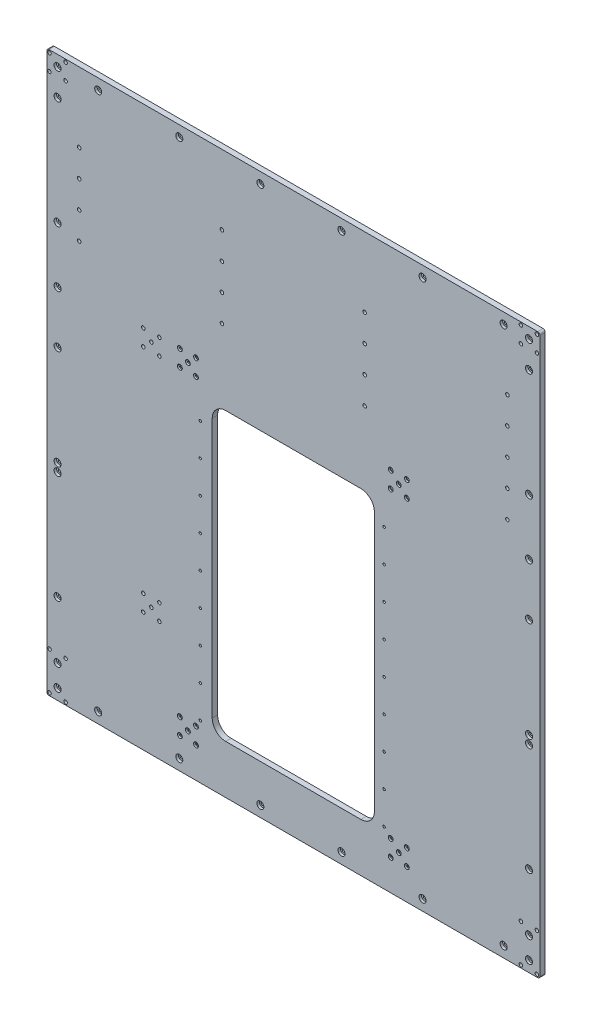
from build123d import *

# Parameters (mm, degrees)
BOSS_EXTRU_1_DEPTH                           = 10
ENL_V_MAT_EXTRU_1_DEPTH                      = 690.813199352
D_GAGEMENT_M64_D                             = 6.6
CHAMBRAGE_POUR_VIS_T_TE_RONDE_BOMB_2_COUNT   = 2
CHAMBRAGE_POUR_VIS_T_TE_RONDE_BOMB_2_PITCH   = 29.81471185
CHAMBRAGE_POUR_VIS_T_TE_RONDE_BOMB_3_COUNT   = 2
CHAMBRAGE_POUR_VIS_T_TE_RONDE_BOMB_3_PITCH   = 21.093697317
CHAMBRAGE_POUR_VIS_T_TE_RONDE_BOMB_4_COUNT   = 2
CHAMBRAGE_POUR_VIS_T_TE_RONDE_BOMB_4_PITCH   = 42.330145982
CHAMBRAGE_POUR_VIS_T_TE_RONDE_BOMB_5_COUNT   = 2
CHAMBRAGE_POUR_VIS_T_TE_RONDE_BOMB_5_PITCH   = 30.048697412
R_P_TITION_LIN_AIRE7_COUNT                   = 2
R_P_TITION_LIN_AIRE7_PITCH                   = 425
D_GAGEMENT_M41_D                             = 4.5
R_P_TITION_LIN_AIRE8_COUNT                   = 9
R_P_TITION_LIN_AIRE8_PITCH                   = 60
R_P_TITION_LIN_AIRE8_COUNT_DIR2              = 2
R_P_TITION_LIN_AIRE8_PITCH_DIR2              = 340
D_GAGEMENT_M65_D                             = 6.6
R_P_TITION_LIN_AIRE9_COUNT                   = 2
R_P_TITION_LIN_AIRE9_PITCH                   = 872
R_P_TITION_LIN_AIRE10_COUNT                  = 6
R_P_TITION_LIN_AIRE10_PITCH                  = 150
R_P_TITION_LIN_AIRE11_COUNT                  = 5
R_P_TITION_LIN_AIRE11_PITCH                  = 200
R_P_TITION_LIN_AIRE11_COUNT_DIR2             = 2
R_P_TITION_LIN_AIRE11_PITCH_DIR2             = 872
CHAMBRAGE_POUR_VIS_T_TE_RONDE_BOMB_9_A_COUNT = 2
CHAMBRAGE_POUR_VIS_T_TE_RONDE_BOMB_9_A_PITCH = 40
R_P_TITION_LIN_AIRE13_COUNT                  = 2
R_P_TITION_LIN_AIRE13_PITCH                  = 872
R_P_TITION_LIN_AIRE14_COUNT                  = 6
R_P_TITION_LIN_AIRE14_PITCH                  = 150
D_GAGEMENT_M66_D                             = 6.6
ESQUISSE41_R                                 = 1.5
ENL_V_MAT_EXTRU_2_DEPTH                      = 690.813199352
CHAMBRAGE_POUR_VIS_T_TE_RONDE_BOMB_12_COUNT  = 2
CHAMBRAGE_POUR_VIS_T_TE_RONDE_BOMB_12_PITCH  = 281
CHAMBRAGE_POUR_VIS_T_TE_RONDE_BOMB_13_COUNT  = 2
CHAMBRAGE_POUR_VIS_T_TE_RONDE_BOMB_13_PITCH  = 916.15773751
CHAMBRAGE_POUR_VIS_T_TE_RONDE_BOMB_14_COUNT  = 2
CHAMBRAGE_POUR_VIS_T_TE_RONDE_BOMB_14_PITCH  = 872
D_GAGEMENT_M67_D                             = 6.6
R_P_TITION_LIN_AIRE15_COUNT                  = 4
R_P_TITION_LIN_AIRE15_PITCH                  = 264
R_P_TITION_LIN_AIRE15_COUNT_DIR2             = 5
R_P_TITION_LIN_AIRE15_PITCH_DIR2             = 50
D_GAGEMENT_M68_D                             = 6.6
CHAMBRAGE_POUR_VIS_T_TE_RONDE_BOMB_16_COUNT  = 2
CHAMBRAGE_POUR_VIS_T_TE_RONDE_BOMB_16_PITCH  = 29.824554091
CHAMBRAGE_POUR_VIS_T_TE_RONDE_BOMB_17_COUNT  = 2
CHAMBRAGE_POUR_VIS_T_TE_RONDE_BOMB_17_PITCH  = 21.18667677
CHAMBRAGE_POUR_VIS_T_TE_RONDE_BOMB_18_COUNT  = 2
CHAMBRAGE_POUR_VIS_T_TE_RONDE_BOMB_18_PITCH  = 42.361305099
CHAMBRAGE_POUR_VIS_T_TE_RONDE_BOMB_19_COUNT  = 2
CHAMBRAGE_POUR_VIS_T_TE_RONDE_BOMB_19_PITCH  = 30.082821392
R_P_TITION_LIN_AIRE16_COUNT                  = 2
R_P_TITION_LIN_AIRE16_PITCH                  = 390
R_P_TITION_LIN_AIRE16_COUNT_DIR2             = 2
R_P_TITION_LIN_AIRE16_PITCH_DIR2             = 590


with BuildPart() as part:
    # Esquisse1 → Boss.-Extru.1 (new body)
    with BuildSketch(Plane.XY):
        with BuildLine():
            Line((-452, -517.5), (452, -517.5))
            ThreePointArc((452, -517.5), (454.828427125, -516.328427125), (456, -513.5))
            Line((456, -513.5), (456, 513.5))
            ThreePointArc((456, 513.5), (454.828427125, 516.328427125), (452, 517.5))
            Line((452, 517.5), (-452, 517.5))
            ThreePointArc((-452, 517.5), (-454.828427125, 516.328427125), (-456, 513.5))
            Line((-456, 513.5), (-456, -513.5))
            ThreePointArc((-456, -513.5), (-454.828427125, -516.328427125), (-452, -517.5))
        make_face()
    extrude(amount=BOSS_EXTRU_1_DEPTH)

    # Esquisse2 → Enlèv. mat.-Extru.1 (cut, through all)
    with BuildSketch(Plane.XY.offset(10)):
        with BuildLine():
            Line((-125, -427.5), (125, -427.5))
            ThreePointArc((125, -427.5), (142.67766953, -420.17766953), (150, -402.5))
            Line((150, -402.5), (150, 77.5))
            ThreePointArc((150, 77.5), (142.67766953, 95.17766953), (125, 102.5))
            Line((125, 102.5), (-125, 102.5))
            ThreePointArc((-125, 102.5), (-142.67766953, 95.17766953), (-150, 77.5))
            Line((-150, 77.5), (-150, -402.5))
            ThreePointArc((-150, -402.5), (-142.67766953, -420.17766953), (-125, -427.5))
        make_face()
    extrude(amount=-ENL_V_MAT_EXTRU_1_DEPTH, mode=Mode.SUBTRACT)

    # Dégagement M64 (through all)
    with Locations(Plane.XY.offset(10)):
        with Locations((-277.5, 158.515604526), (-247.68528815, 158.515604526), (-247.68528815, 128.466907114), (-277.5, 128.466907114), (-262.5, 143.5)):
            Hole(D_GAGEMENT_M64_D / 2)

    # Esquisse21 → Chambrage pour vis _ t_te ronde bomb_e M (revolve, cut)
    with BuildSketch(Plane(origin=(-247.68528815, 158.515604526, 0), x_dir=(0, 1, 0), z_dir=(1, 0, 0))):
        Polygon((0, 0), (0, 10), (3.3, 10), (3.3, 4.625), (3.325, 4.6), (6.5, 4.6), (6.5, 0), align=None)
    chambrage_pour_vis_t_te_ronde_bomb_e_m = revolve(axis=Axis((-247.68528815, 158.515604526, -6.35), (0, 0, 1)), mode=Mode.SUBTRACT)

    # Chambrage pour vis _ t_te ronde bomb 2: Chambrage pour vis _ t_te ronde bomb_e M ×2
    with Locations(*[(-i * CHAMBRAGE_POUR_VIS_T_TE_RONDE_BOMB_2_PITCH, 0, 0) for i in range(1, CHAMBRAGE_POUR_VIS_T_TE_RONDE_BOMB_2_COUNT)]):
        add(chambrage_pour_vis_t_te_ronde_bomb_e_m, mode=Mode.SUBTRACT)

    # Chambrage pour vis _ t_te ronde bomb 3: Chambrage pour vis _ t_te ronde bomb_e M ×2
    with Locations(*[Vector(-0.7023288344180294, -0.7118526591542749, 0) * (i * CHAMBRAGE_POUR_VIS_T_TE_RONDE_BOMB_3_PITCH) for i in range(1, CHAMBRAGE_POUR_VIS_T_TE_RONDE_BOMB_3_COUNT)]):
        add(chambrage_pour_vis_t_te_ronde_bomb_e_m, mode=Mode.SUBTRACT)

    # Chambrage pour vis _ t_te ronde bomb 4: Chambrage pour vis _ t_te ronde bomb_e M ×2
    with Locations(*[Vector(-0.7043375627044492, -0.7098651968955486, 0) * (i * CHAMBRAGE_POUR_VIS_T_TE_RONDE_BOMB_4_PITCH) for i in range(1, CHAMBRAGE_POUR_VIS_T_TE_RONDE_BOMB_4_COUNT)]):
        add(chambrage_pour_vis_t_te_ronde_bomb_e_m, mode=Mode.SUBTRACT)

    # Chambrage pour vis _ t_te ronde bomb 5: Chambrage pour vis _ t_te ronde bomb_e M ×2
    with Locations(*[(0, -i * CHAMBRAGE_POUR_VIS_T_TE_RONDE_BOMB_5_PITCH, 0) for i in range(1, CHAMBRAGE_POUR_VIS_T_TE_RONDE_BOMB_5_COUNT)]):
        add(chambrage_pour_vis_t_te_ronde_bomb_e_m, mode=Mode.SUBTRACT)

    # Répétition linéaire7: Chambrage pour vis _ t_te ronde bomb_e M ×2
    with Locations(*[(0, -i * R_P_TITION_LIN_AIRE7_PITCH, 0) for i in range(1, R_P_TITION_LIN_AIRE7_COUNT)]):
        add(chambrage_pour_vis_t_te_ronde_bomb_e_m, mode=Mode.SUBTRACT)

    # Répétition linéaire7 copy 1 sketch → Répétition linéaire7 copy 1 (revolve, cut)
    with BuildSketch(Plane(origin=(-277.5, -266.484395474, 0), x_dir=(0, 1, 0), z_dir=(1, 0, 0))):
        Polygon((0, 0), (0, 10), (3.3, 10), (3.3, 4.625), (3.325, 4.6), (6.5, 4.6), (6.5, 0), align=None)
    revolve(axis=Axis((-277.5, -266.484395474, -6.35), (0, 0, 1)), mode=Mode.SUBTRACT)

    # Répétition linéaire7 copy 2 sketch → Répétition linéaire7 copy 2 (revolve, cut)
    with BuildSketch(Plane(origin=(-262.5, -281.5, 0), x_dir=(0, 1, 0), z_dir=(1, 0, 0))):
        Polygon((0, 0), (0, 10), (3.3, 10), (3.3, 4.625), (3.325, 4.6), (6.5, 4.6), (6.5, 0), align=None)
    revolve(axis=Axis((-262.5, -281.5, -6.35), (0, 0, 1)), mode=Mode.SUBTRACT)

    # Répétition linéaire7 copy 3 sketch → Répétition linéaire7 copy 3 (revolve, cut)
    with BuildSketch(Plane(origin=(-277.5, -296.533092886, 0), x_dir=(0, 1, 0), z_dir=(1, 0, 0))):
        Polygon((0, 0), (0, 10), (3.3, 10), (3.3, 4.625), (3.325, 4.6), (6.5, 4.6), (6.5, 0), align=None)
    revolve(axis=Axis((-277.5, -296.533092886, -6.35), (0, 0, 1)), mode=Mode.SUBTRACT)

    # Répétition linéaire7 copy 4 sketch → Répétition linéaire7 copy 4 (revolve, cut)
    with BuildSketch(Plane(origin=(-247.68528815, -296.533092886, 0), x_dir=(0, 1, 0), z_dir=(1, 0, 0))):
        Polygon((0, 0), (0, 10), (3.3, 10), (3.3, 4.625), (3.325, 4.6), (6.5, 4.6), (6.5, 0), align=None)
    revolve(axis=Axis((-247.68528815, -296.533092886, -6.35), (0, 0, 1)), mode=Mode.SUBTRACT)

    # Dégagement M41 (through all)
    with Locations(Plane.XY.offset(10)):
        with Locations((-172, -417.5)):
            d_gagement_m41 = Hole(D_GAGEMENT_M41_D / 2)

    # Répétition linéaire8: D_gagement M41 9 × 2
    with Locations(*[(j * R_P_TITION_LIN_AIRE8_PITCH_DIR2, i * R_P_TITION_LIN_AIRE8_PITCH, 0) for i in range(R_P_TITION_LIN_AIRE8_COUNT) for j in range(R_P_TITION_LIN_AIRE8_COUNT_DIR2) if (i, j) != (0, 0)]):
        add(d_gagement_m41, mode=Mode.SUBTRACT)

    # Dégagement M65 (through all)
    with Locations(Plane(origin=(0, 0, 0), x_dir=(-1, 0, 0), z_dir=(0, 0, -1))):
        with Locations((-436.000000001, 497.5), (-421.000000001, 512.508152755), (-450.633748866, 512.508152755), (-450.633748866, 482.515397158), (-421.000000001, 482.684847754), (-436.000000001, 448.286376646), (-389.123182304, 497.5), (-421.000000001, -442.645203276), (-450.633748866, -442.417266528), (-436.000000001, -457.5), (-436.000000001, -497.5), (-450.633748866, -512.5), (-421.000000001, -512.5), (-389.123182304, -497.5), (421.183518058, -442.600682692), (450.908059857, -442.392818763), (435.999999999, -457.5), (435.999999999, -497.5), (450.908059857, -512.5), (421.183518058, -512.5)):
            Hole(D_GAGEMENT_M65_D / 2)

    # Esquisse27 → Chambrage pour vis _ t_te ronde bomb 6 (revolve, cut)
    with BuildSketch(Plane(origin=(436.000000001, 497.5, 10), x_dir=(0, -1, 0), z_dir=(1, 0, 0))):
        Polygon((0, 0), (0, 10), (3.3, 10), (3.3, 4.625), (3.325, 4.6), (6.5, 4.6), (6.5, 0), align=None)
    chambrage_pour_vis_t_te_ronde_bomb_6 = revolve(axis=Axis((436.000000001, 497.5, 16.35), (0, 0, -1)), mode=Mode.SUBTRACT)

    # Répétition linéaire9: Chambrage pour vis _ t_te ronde bomb 6 ×2
    with Locations(*[(-i * R_P_TITION_LIN_AIRE9_PITCH, 0, 0) for i in range(1, R_P_TITION_LIN_AIRE9_COUNT)]):
        add(chambrage_pour_vis_t_te_ronde_bomb_6, mode=Mode.SUBTRACT)

    # Esquisse29 → Chambrage pour vis _ t_te ronde bomb 7 (revolve, cut)
    with BuildSketch(Plane(origin=(389.123182304, 497.5, 10), x_dir=(0, -1, 0), z_dir=(1, 0, 0))):
        Polygon((0, 0), (0, 10), (3.3, 10), (3.3, 4.625), (3.325, 4.6), (6.5, 4.6), (6.5, 0), align=None)
    chambrage_pour_vis_t_te_ronde_bomb_7 = revolve(axis=Axis((389.123182304, 497.5, 16.35), (0, 0, -1)), mode=Mode.SUBTRACT)

    # Répétition linéaire10: Chambrage pour vis _ t_te ronde bomb 7 ×6
    with Locations(*[(-i * R_P_TITION_LIN_AIRE10_PITCH, 0, 0) for i in range(1, R_P_TITION_LIN_AIRE10_COUNT)]):
        add(chambrage_pour_vis_t_te_ronde_bomb_7, mode=Mode.SUBTRACT)

    # Esquisse31 → Chambrage pour vis _ t_te ronde bomb 8 (revolve, cut)
    with BuildSketch(Plane(origin=(436.000000001, 448.286376646, 10), x_dir=(0, -1, 0), z_dir=(1, 0, 0))):
        Polygon((0, 0), (0, 10), (3.3, 10), (3.3, 4.625), (3.325, 4.6), (6.5, 4.6), (6.5, 0), align=None)
    chambrage_pour_vis_t_te_ronde_bomb_8 = revolve(axis=Axis((436.000000001, 448.286376646, 16.35), (0, 0, -1)), mode=Mode.SUBTRACT)

    # Répétition linéaire11: Chambrage pour vis _ t_te ronde bomb 8 5 × 2
    with Locations(*[(-j * R_P_TITION_LIN_AIRE11_PITCH_DIR2, -i * R_P_TITION_LIN_AIRE11_PITCH, 0) for i in range(R_P_TITION_LIN_AIRE11_COUNT) for j in range(R_P_TITION_LIN_AIRE11_COUNT_DIR2) if (i, j) != (0, 0)]):
        add(chambrage_pour_vis_t_te_ronde_bomb_8, mode=Mode.SUBTRACT)

    # Esquisse33 → Chambrage pour vis _ t_te ronde bomb 9 (revolve, cut)
    with BuildSketch(Plane(origin=(436.000000001, -457.5, 10), x_dir=(0, -1, 0), z_dir=(1, 0, 0))):
        Polygon((0, 0), (0, 10), (3.3, 10), (3.3, 4.625), (3.325, 4.6), (6.5, 4.6), (6.5, 0), align=None)
    chambrage_pour_vis_t_te_ronde_bomb_9 = revolve(axis=Axis((436.000000001, -457.5, 16.35), (0, 0, -1)), mode=Mode.SUBTRACT)

    # Chambrage pour vis _ t_te ronde bomb 9 a: Chambrage pour vis _ t_te ronde bomb 9 ×2
    with Locations(*[(0, -i * CHAMBRAGE_POUR_VIS_T_TE_RONDE_BOMB_9_A_PITCH, 0) for i in range(1, CHAMBRAGE_POUR_VIS_T_TE_RONDE_BOMB_9_A_COUNT)]):
        add(chambrage_pour_vis_t_te_ronde_bomb_9, mode=Mode.SUBTRACT)

    # Répétition linéaire13: Chambrage pour vis _ t_te ronde bomb 9 ×2
    with Locations(*[(-i * R_P_TITION_LIN_AIRE13_PITCH, 0, 0) for i in range(1, R_P_TITION_LIN_AIRE13_COUNT)]):
        add(chambrage_pour_vis_t_te_ronde_bomb_9, mode=Mode.SUBTRACT)

    # Répétition linéaire13 copy 1 sketch → Répétition linéaire13 copy 1 (revolve, cut)
    with BuildSketch(Plane(origin=(-435.999999999, -497.5, 10), x_dir=(0, -1, 0), z_dir=(1, 0, 0))):
        Polygon((0, 0), (0, 10), (3.3, 10), (3.3, 4.625), (3.325, 4.6), (6.5, 4.6), (6.5, 0), align=None)
    revolve(axis=Axis((-435.999999999, -497.5, 16.35), (0, 0, -1)), mode=Mode.SUBTRACT)

    # Esquisse35 → Chambrage pour vis _ t_te ronde bomb 10 (revolve, cut)
    with BuildSketch(Plane(origin=(389.123182304, -497.5, 10), x_dir=(0, -1, 0), z_dir=(1, 0, 0))):
        Polygon((0, 0), (0, 10), (3.3, 10), (3.3, 4.625), (3.325, 4.6), (6.5, 4.6), (6.5, 0), align=None)
    chambrage_pour_vis_t_te_ronde_bomb_10 = revolve(axis=Axis((389.123182304, -497.5, 16.35), (0, 0, -1)), mode=Mode.SUBTRACT)

    # Répétition linéaire14: Chambrage pour vis _ t_te ronde bomb 10 ×6
    with Locations(*[(-i * R_P_TITION_LIN_AIRE14_PITCH, 0, 0) for i in range(1, R_P_TITION_LIN_AIRE14_COUNT)]):
        add(chambrage_pour_vis_t_te_ronde_bomb_10, mode=Mode.SUBTRACT)

    # Dégagement M66 (through all)
    with Locations(Plane(origin=(0, 0, 0), x_dir=(-1, 0, 0), z_dir=(0, 0, -1))):
        with Locations((421.185682092, 512.436649225), (450.992654505, 512.436649225), (450.992654505, 482.629676813), (421.185682092, 482.629676813)):
            Hole(D_GAGEMENT_M66_D / 2)

    # Esquisse41 → Enlèv. mat.-Extru.2 (cut, through all)
    with BuildSketch(Plane.XY.offset(10)):
        with Locations((-436, 144.5)):
            Circle(ESQUISSE41_R)
        with Locations((-436, -136.5)):
            Circle(ESQUISSE41_R)
    enl_v_mat_extru_2 = extrude(amount=-ENL_V_MAT_EXTRU_2_DEPTH, mode=Mode.SUBTRACT)

    # Symétrie1: Enlèv. mat.-Extru.2 across plane
    add(enl_v_mat_extru_2.mirror(Plane(origin=(0, 0, 0), x_dir=(0, 0, 1), z_dir=(1, 0, 0))), mode=Mode.SUBTRACT)

    # Esquisse44 → Chambrage pour vis _ t_te ronde bomb 11 (revolve, cut)
    with BuildSketch(Plane(origin=(-436, 144.5, 10), x_dir=(0, -1, 0), z_dir=(1, 0, 0))):
        Polygon((0, 0), (0, 10), (3.3, 10), (3.3, 4.625), (3.325, 4.6), (6.5, 4.6), (6.5, 0), align=None)
    chambrage_pour_vis_t_te_ronde_bomb_11 = revolve(axis=Axis((-436, 144.5, 16.35), (0, 0, -1)), mode=Mode.SUBTRACT)

    # Chambrage pour vis _ t_te ronde bomb 12: Chambrage pour vis _ t_te ronde bomb 11 ×2
    with Locations(*[(0, -i * CHAMBRAGE_POUR_VIS_T_TE_RONDE_BOMB_12_PITCH, 0) for i in range(1, CHAMBRAGE_POUR_VIS_T_TE_RONDE_BOMB_12_COUNT)]):
        add(chambrage_pour_vis_t_te_ronde_bomb_11, mode=Mode.SUBTRACT)

    # Chambrage pour vis _ t_te ronde bomb 13: Chambrage pour vis _ t_te ronde bomb 11 ×2
    with Locations(*[Vector(0.9518011629413234, -0.306715741727653, 0) * (i * CHAMBRAGE_POUR_VIS_T_TE_RONDE_BOMB_13_PITCH) for i in range(1, CHAMBRAGE_POUR_VIS_T_TE_RONDE_BOMB_13_COUNT)]):
        add(chambrage_pour_vis_t_te_ronde_bomb_11, mode=Mode.SUBTRACT)

    # Chambrage pour vis _ t_te ronde bomb 14: Chambrage pour vis _ t_te ronde bomb 11 ×2
    with Locations(*[(i * CHAMBRAGE_POUR_VIS_T_TE_RONDE_BOMB_14_PITCH, 0, 0) for i in range(1, CHAMBRAGE_POUR_VIS_T_TE_RONDE_BOMB_14_COUNT)]):
        add(chambrage_pour_vis_t_te_ronde_bomb_11, mode=Mode.SUBTRACT)

    # Dégagement M67 (through all)
    with Locations(Plane(origin=(0, 0, 0), x_dir=(-1, 0, 0), z_dir=(0, 0, -1))):
        with Locations((-396.00143494, 188.397832099)):
            d_gagement_m67 = Hole(D_GAGEMENT_M67_D / 2)

    # Répétition linéaire15: D_gagement M67 4 × 5, 3 skipped
    with Locations(*[(-i * R_P_TITION_LIN_AIRE15_PITCH, j * R_P_TITION_LIN_AIRE15_PITCH_DIR2, 0) for i in range(R_P_TITION_LIN_AIRE15_COUNT) for j in range(R_P_TITION_LIN_AIRE15_COUNT_DIR2) if (i, j) not in ((0, 0), (1, 0), (2, 0), (3, 0))]):
        add(d_gagement_m67, mode=Mode.SUBTRACT)

    # Dégagement M68 (through all)
    with Locations(Plane(origin=(0, 0, 0), x_dir=(-1, 0, 0), z_dir=(0, 0, -1))):
        with Locations((-210, 159.636309607), (-180.175445909, 159.636309607), (-180.175445909, 129.553488215), (-210, 129.553488215), (-195, 144.5)):
            Hole(D_GAGEMENT_M68_D / 2)

    # Esquisse49 → Chambrage pour vis _ t_te ronde bomb 15 (revolve, cut)
    with BuildSketch(Plane(origin=(180.175445909, 159.636309607, 10), x_dir=(0, -1, 0), z_dir=(1, 0, 0))):
        Polygon((0, 0), (0, 10), (2.25, 10), (2.25, 3.125), (2.275, 3.1), (4.5, 3.1), (4.5, 0), align=None)
    chambrage_pour_vis_t_te_ronde_bomb_15 = revolve(axis=Axis((180.175445909, 159.636309607, 16.35), (0, 0, -1)), mode=Mode.SUBTRACT)

    # Chambrage pour vis _ t_te ronde bomb 16: Chambrage pour vis _ t_te ronde bomb 15 ×2
    with Locations(*[(i * CHAMBRAGE_POUR_VIS_T_TE_RONDE_BOMB_16_PITCH, 0, 0) for i in range(1, CHAMBRAGE_POUR_VIS_T_TE_RONDE_BOMB_16_COUNT)]):
        add(chambrage_pour_vis_t_te_ronde_bomb_15, mode=Mode.SUBTRACT)

    # Chambrage pour vis _ t_te ronde bomb 17: Chambrage pour vis _ t_te ronde bomb 15 ×2
    with Locations(*[Vector(0.699711155865829, -0.7144258522456377, 0) * (i * CHAMBRAGE_POUR_VIS_T_TE_RONDE_BOMB_17_PITCH) for i in range(1, CHAMBRAGE_POUR_VIS_T_TE_RONDE_BOMB_17_COUNT)]):
        add(chambrage_pour_vis_t_te_ronde_bomb_15, mode=Mode.SUBTRACT)

    # Chambrage pour vis _ t_te ronde bomb 18: Chambrage pour vis _ t_te ronde bomb 15 ×2
    with Locations(*[Vector(0.704051823280884, -0.7101485972209359, 0) * (i * CHAMBRAGE_POUR_VIS_T_TE_RONDE_BOMB_18_PITCH) for i in range(1, CHAMBRAGE_POUR_VIS_T_TE_RONDE_BOMB_18_COUNT)]):
        add(chambrage_pour_vis_t_te_ronde_bomb_15, mode=Mode.SUBTRACT)

    # Chambrage pour vis _ t_te ronde bomb 19: Chambrage pour vis _ t_te ronde bomb 15 ×2
    with Locations(*[(0, -i * CHAMBRAGE_POUR_VIS_T_TE_RONDE_BOMB_19_PITCH, 0) for i in range(1, CHAMBRAGE_POUR_VIS_T_TE_RONDE_BOMB_19_COUNT)]):
        add(chambrage_pour_vis_t_te_ronde_bomb_15, mode=Mode.SUBTRACT)

    # Répétition linéaire16: Chambrage pour vis _ t_te ronde bomb 15 2 × 2
    with Locations(*[(-i * R_P_TITION_LIN_AIRE16_PITCH, -j * R_P_TITION_LIN_AIRE16_PITCH_DIR2, 0) for i in range(R_P_TITION_LIN_AIRE16_COUNT) for j in range(R_P_TITION_LIN_AIRE16_COUNT_DIR2) if (i, j) != (0, 0)]):
        add(chambrage_pour_vis_t_te_ronde_bomb_15, mode=Mode.SUBTRACT)

    # Répétition linéaire16 copy 1 sketch → Répétition linéaire16 copy 1 (revolve, cut)
    with BuildSketch(Plane(origin=(210, -430.363690393, 10), x_dir=(0, -1, 0), z_dir=(1, 0, 0))):
        Polygon((0, 0), (0, 10), (2.25, 10), (2.25, 3.125), (2.275, 3.1), (4.5, 3.1), (4.5, 0), align=None)
    revolve(axis=Axis((210, -430.363690393, 16.35), (0, 0, -1)), mode=Mode.SUBTRACT)

    # Répétition linéaire16 copy 2 sketch → Répétition linéaire16 copy 2 (revolve, cut)
    with BuildSketch(Plane(origin=(-180, 159.636309607, 10), x_dir=(0, -1, 0), z_dir=(1, 0, 0))):
        Polygon((0, 0), (0, 10), (2.25, 10), (2.25, 3.125), (2.275, 3.1), (4.5, 3.1), (4.5, 0), align=None)
    revolve(axis=Axis((-180, 159.636309607, 16.35), (0, 0, -1)), mode=Mode.SUBTRACT)

    # Répétition linéaire16 copy 3 sketch → Répétition linéaire16 copy 3 (revolve, cut)
    with BuildSketch(Plane(origin=(-180, -430.363690393, 10), x_dir=(0, -1, 0), z_dir=(1, 0, 0))):
        Polygon((0, 0), (0, 10), (2.25, 10), (2.25, 3.125), (2.275, 3.1), (4.5, 3.1), (4.5, 0), align=None)
    revolve(axis=Axis((-180, -430.363690393, 16.35), (0, 0, -1)), mode=Mode.SUBTRACT)

    # Répétition linéaire16 copy 4 sketch → Répétition linéaire16 copy 4 (revolve, cut)
    with BuildSketch(Plane(origin=(195, -445.5, 10), x_dir=(0, -1, 0), z_dir=(1, 0, 0))):
        Polygon((0, 0), (0, 10), (2.25, 10), (2.25, 3.125), (2.275, 3.1), (4.5, 3.1), (4.5, 0), align=None)
    revolve(axis=Axis((195, -445.5, 16.35), (0, 0, -1)), mode=Mode.SUBTRACT)

    # Répétition linéaire16 copy 5 sketch → Répétition linéaire16 copy 5 (revolve, cut)
    with BuildSketch(Plane(origin=(-195, 144.5, 10), x_dir=(0, -1, 0), z_dir=(1, 0, 0))):
        Polygon((0, 0), (0, 10), (2.25, 10), (2.25, 3.125), (2.275, 3.1), (4.5, 3.1), (4.5, 0), align=None)
    revolve(axis=Axis((-195, 144.5, 16.35), (0, 0, -1)), mode=Mode.SUBTRACT)

    # Répétition linéaire16 copy 6 sketch → Répétition linéaire16 copy 6 (revolve, cut)
    with BuildSketch(Plane(origin=(-195, -445.5, 10), x_dir=(0, -1, 0), z_dir=(1, 0, 0))):
        Polygon((0, 0), (0, 10), (2.25, 10), (2.25, 3.125), (2.275, 3.1), (4.5, 3.1), (4.5, 0), align=None)
    revolve(axis=Axis((-195, -445.5, 16.35), (0, 0, -1)), mode=Mode.SUBTRACT)

    # Répétition linéaire16 copy 7 sketch → Répétition linéaire16 copy 7 (revolve, cut)
    with BuildSketch(Plane(origin=(210, -460.446511785, 10), x_dir=(0, -1, 0), z_dir=(1, 0, 0))):
        Polygon((0, 0), (0, 10), (2.25, 10), (2.25, 3.125), (2.275, 3.1), (4.5, 3.1), (4.5, 0), align=None)
    revolve(axis=Axis((210, -460.446511785, 16.35), (0, 0, -1)), mode=Mode.SUBTRACT)

    # Répétition linéaire16 copy 8 sketch → Répétition linéaire16 copy 8 (revolve, cut)
    with BuildSketch(Plane(origin=(-180, 129.553488215, 10), x_dir=(0, -1, 0), z_dir=(1, 0, 0))):
        Polygon((0, 0), (0, 10), (2.25, 10), (2.25, 3.125), (2.275, 3.1), (4.5, 3.1), (4.5, 0), align=None)
    revolve(axis=Axis((-180, 129.553488215, 16.35), (0, 0, -1)), mode=Mode.SUBTRACT)

    # Répétition linéaire16 copy 9 sketch → Répétition linéaire16 copy 9 (revolve, cut)
    with BuildSketch(Plane(origin=(-180, -460.446511785, 10), x_dir=(0, -1, 0), z_dir=(1, 0, 0))):
        Polygon((0, 0), (0, 10), (2.25, 10), (2.25, 3.125), (2.275, 3.1), (4.5, 3.1), (4.5, 0), align=None)
    revolve(axis=Axis((-180, -460.446511785, 16.35), (0, 0, -1)), mode=Mode.SUBTRACT)

    # Répétition linéaire16 copy 10 sketch → Répétition linéaire16 copy 10 (revolve, cut)
    with BuildSketch(Plane(origin=(180.175445909, -460.446511785, 10), x_dir=(0, -1, 0), z_dir=(1, 0, 0))):
        Polygon((0, 0), (0, 10), (2.25, 10), (2.25, 3.125), (2.275, 3.1), (4.5, 3.1), (4.5, 0), align=None)
    revolve(axis=Axis((180.175445909, -460.446511785, 16.35), (0, 0, -1)), mode=Mode.SUBTRACT)

    # Répétition linéaire16 copy 11 sketch → Répétition linéaire16 copy 11 (revolve, cut)
    with BuildSketch(Plane(origin=(-209.824554091, 129.553488215, 10), x_dir=(0, -1, 0), z_dir=(1, 0, 0))):
        Polygon((0, 0), (0, 10), (2.25, 10), (2.25, 3.125), (2.275, 3.1), (4.5, 3.1), (4.5, 0), align=None)
    revolve(axis=Axis((-209.824554091, 129.553488215, 16.35), (0, 0, -1)), mode=Mode.SUBTRACT)

    # Répétition linéaire16 copy 12 sketch → Répétition linéaire16 copy 12 (revolve, cut)
    with BuildSketch(Plane(origin=(-209.824554091, -460.446511785, 10), x_dir=(0, -1, 0), z_dir=(1, 0, 0))):
        Polygon((0, 0), (0, 10), (2.25, 10), (2.25, 3.125), (2.275, 3.1), (4.5, 3.1), (4.5, 0), align=None)
    revolve(axis=Axis((-209.824554091, -460.446511785, 16.35), (0, 0, -1)), mode=Mode.SUBTRACT)


solid = part.part
